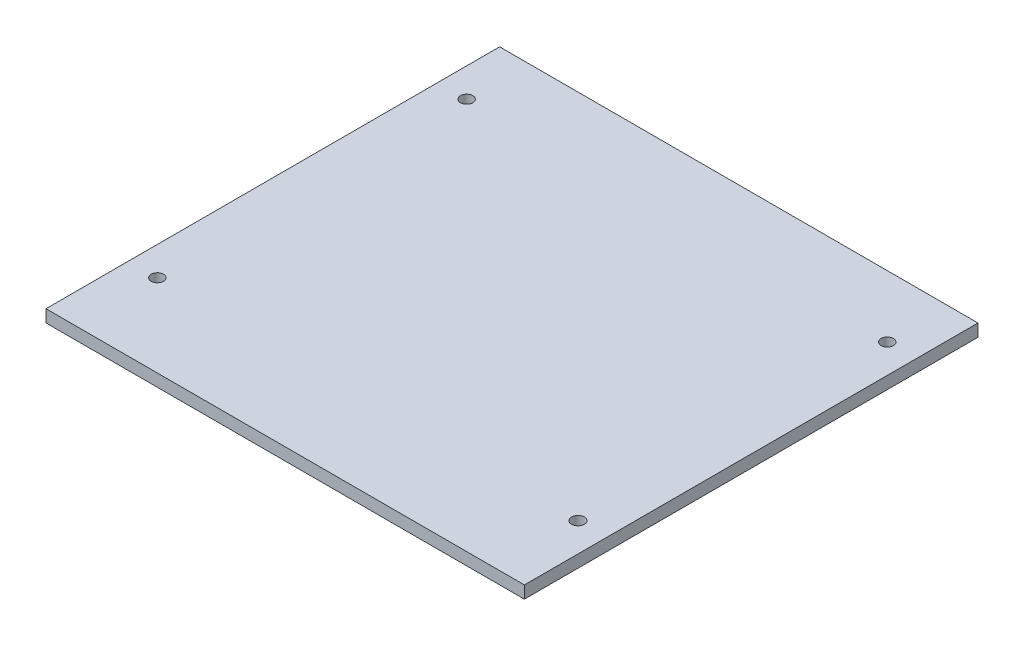
from build123d import *

# Parameters (mm, degrees)
SKETCH_1_W          = 116
SKETCH_1_H          = 110
EXTRUDE_1_DEPTH     = 3
SKETCH_2_R          = 1.5
SKETCH_2_R_2        = 1.55
CUT_EXTRUDE_1_DEPTH = 10


with BuildPart() as part:
    # 草图1 → 凸台-拉伸1 (new body)
    with BuildSketch(Plane(origin=(0, 0, 0), x_dir=(1, 0, 0), z_dir=(0, 1, 0))):
        Rectangle(SKETCH_1_W, SKETCH_1_H)
    extrude(amount=EXTRUDE_1_DEPTH)

    # 草图2 → 切除-拉伸1 (cut)
    with BuildSketch(Plane.XZ):
        with Locations((-51, 35)):
            Circle(SKETCH_2_R)
        with Locations((51, 35)):
            Circle(SKETCH_2_R_2)
        with Locations((51, -40)):
            Circle(SKETCH_2_R)
        with Locations((-51, -40)):
            Circle(SKETCH_2_R)
    extrude(amount=-CUT_EXTRUDE_1_DEPTH, mode=Mode.SUBTRACT)


solid = part.part
